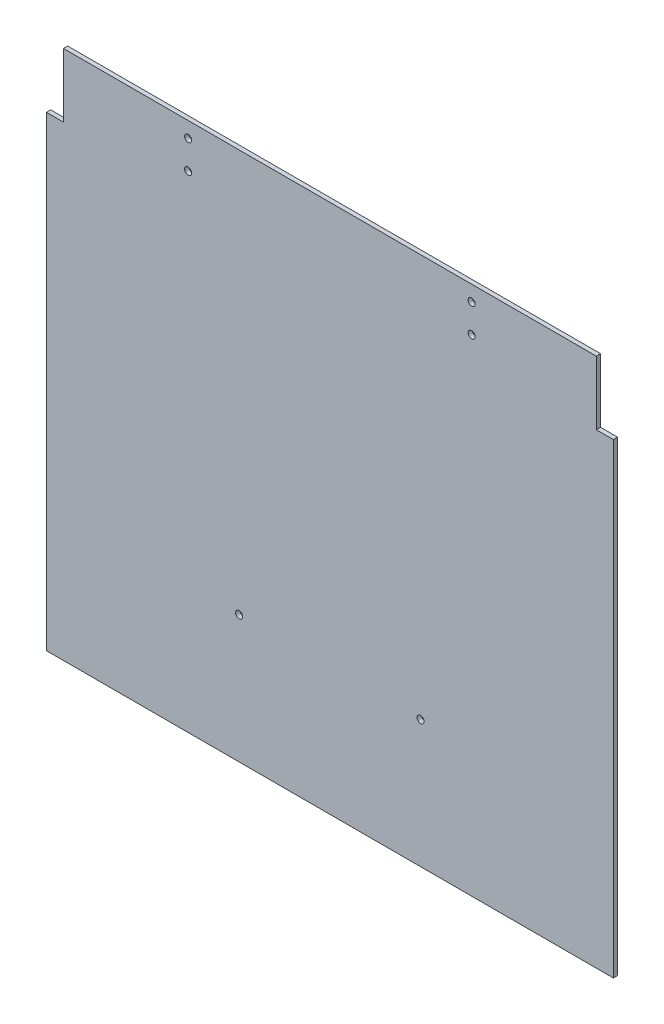
from build123d import *

# Parameters (mm, degrees)
SKETCH1_W           = 400
SKETCH1_H           = 374
BOSS_EXTRUDE1_DEPTH = 3
CUT_EXTRUDE1_REACH  = 275.821
SKETCH2_R           = 2.5
SKETCH2_W           = 12
SKETCH2_H           = 45
CUT_EXTRUDE2_REACH  = 275.821
SKETCH3_R           = 2.5


with BuildPart() as part:
    # Sketch1 → Boss-Extrude1 (new body)
    with BuildSketch(Plane.XY):
        Rectangle(SKETCH1_W, SKETCH1_H)
    extrude(amount=BOSS_EXTRUDE1_DEPTH)

    # Sketch2 → Cut-Extrude1 (cut, up to next)
    with BuildSketch(Plane(origin=(0, 0, 0), x_dir=(-1, 0, 0), z_dir=(0, 0, -1)), mode=Mode.PRIVATE) as cut_extrude1_sk1:
        with Locations((-100, 176.06)):
            Circle(SKETCH2_R)
    cut_extrude1_tool1 = extrude(cut_extrude1_sk1.sketch, amount=-CUT_EXTRUDE1_REACH, mode=Mode.PRIVATE) & part.part
    # Sketch2 → Cut-Extrude1 (cut, up to next)
    with BuildSketch(Plane(origin=(0, 0, 0), x_dir=(-1, 0, 0), z_dir=(0, 0, -1)), mode=Mode.PRIVATE) as cut_extrude1_sk2:
        with Locations((-100, 156.06)):
            Circle(SKETCH2_R)
    cut_extrude1_tool2 = extrude(cut_extrude1_sk2.sketch, amount=-CUT_EXTRUDE1_REACH, mode=Mode.PRIVATE) & part.part
    # Sketch2 → Cut-Extrude1 (cut, up to next)
    with BuildSketch(Plane(origin=(0, 0, 0), x_dir=(-1, 0, 0), z_dir=(0, 0, -1)), mode=Mode.PRIVATE) as cut_extrude1_sk3:
        with Locations((100, 156.06)):
            Circle(SKETCH2_R)
    cut_extrude1_tool3 = extrude(cut_extrude1_sk3.sketch, amount=-CUT_EXTRUDE1_REACH, mode=Mode.PRIVATE) & part.part
    # Sketch2 → Cut-Extrude1 (cut, up to next)
    with BuildSketch(Plane(origin=(0, 0, 0), x_dir=(-1, 0, 0), z_dir=(0, 0, -1)), mode=Mode.PRIVATE) as cut_extrude1_sk4:
        with Locations((100, 176.06)):
            Circle(SKETCH2_R)
    cut_extrude1_tool4 = extrude(cut_extrude1_sk4.sketch, amount=-CUT_EXTRUDE1_REACH, mode=Mode.PRIVATE) & part.part
    # Sketch2 → Cut-Extrude1 (cut, up to next)
    with BuildSketch(Plane(origin=(0, 0, 0), x_dir=(-1, 0, 0), z_dir=(0, 0, -1)), mode=Mode.PRIVATE) as cut_extrude1_sk5:
        with Locations((-194, 164.5)):
            Rectangle(SKETCH2_W, SKETCH2_H)
    cut_extrude1_tool5 = extrude(cut_extrude1_sk5.sketch, amount=-CUT_EXTRUDE1_REACH, mode=Mode.PRIVATE) & part.part
    # Sketch2 → Cut-Extrude1 (cut, up to next)
    with BuildSketch(Plane(origin=(0, 0, 0), x_dir=(-1, 0, 0), z_dir=(0, 0, -1)), mode=Mode.PRIVATE) as cut_extrude1_sk6:
        with Locations((194, 164.5)):
            Rectangle(SKETCH2_W, SKETCH2_H)
    cut_extrude1_tool6 = extrude(cut_extrude1_sk6.sketch, amount=-CUT_EXTRUDE1_REACH, mode=Mode.PRIVATE) & part.part
    add(cut_extrude1_tool1.solids().sort_by_distance((100, 176.06, 0))[0], mode=Mode.SUBTRACT)
    add(cut_extrude1_tool2.solids().sort_by_distance((100, 156.06, 0))[0], mode=Mode.SUBTRACT)
    add(cut_extrude1_tool3.solids().sort_by_distance((-100, 156.06, 0))[0], mode=Mode.SUBTRACT)
    add(cut_extrude1_tool4.solids().sort_by_distance((-100, 176.06, 0))[0], mode=Mode.SUBTRACT)
    add(cut_extrude1_tool5.solids().sort_by_distance((194, 164.5, 0))[0], mode=Mode.SUBTRACT)
    add(cut_extrude1_tool6.solids().sort_by_distance((-194, 164.5, 0))[0], mode=Mode.SUBTRACT)

    # Sketch3 → Cut-Extrude2 (cut, up to next)
    with BuildSketch(Plane(origin=(0, 0, 0), x_dir=(-1, 0, 0), z_dir=(0, 0, -1)), mode=Mode.PRIVATE) as cut_extrude2_sk1:
        with Locations((64, -97)):
            Circle(SKETCH3_R)
    cut_extrude2_tool1 = extrude(cut_extrude2_sk1.sketch, amount=-CUT_EXTRUDE2_REACH, mode=Mode.PRIVATE) & part.part
    # Sketch3 → Cut-Extrude2 (cut, up to next)
    with BuildSketch(Plane(origin=(0, 0, 0), x_dir=(-1, 0, 0), z_dir=(0, 0, -1)), mode=Mode.PRIVATE) as cut_extrude2_sk2:
        with Locations((-64, -97)):
            Circle(SKETCH3_R)
    cut_extrude2_tool2 = extrude(cut_extrude2_sk2.sketch, amount=-CUT_EXTRUDE2_REACH, mode=Mode.PRIVATE) & part.part
    add(cut_extrude2_tool1.solids().sort_by_distance((-64, -97, 0))[0], mode=Mode.SUBTRACT)
    add(cut_extrude2_tool2.solids().sort_by_distance((64, -97, 0))[0], mode=Mode.SUBTRACT)


solid = part.part
